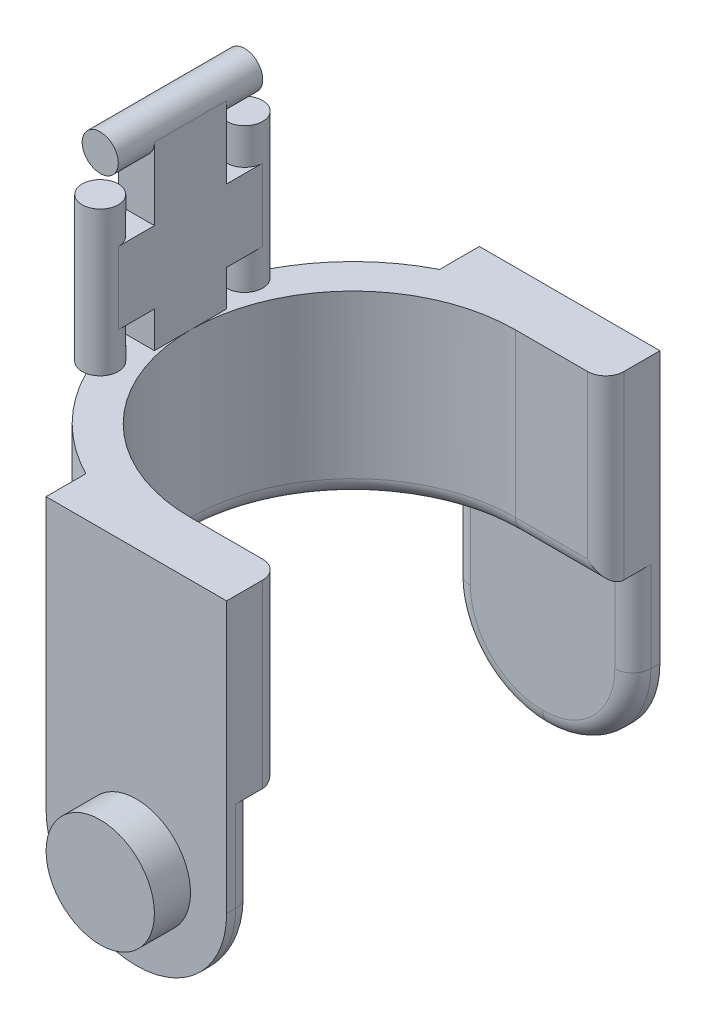
from build123d import *

# Parameters (mm, degrees)
BOSS_EXTRUDE1_DEPTH      = 50
SKETCH2_W                = 50
SKETCH2_H                = 15
BOSS_EXTRUDE2_DEPTH      = 50
SKETCH3_W                = 50
SKETCH3_H                = 7.5
BOSS_EXTRUDE3_DEPTH      = 50
SKETCH4_R                = 15
BOSS_EXTRUDE4_DEPTH      = 10
FILLET1_R                = 25
FILLET1_OF_MIRROR1_R     = 25
FILLET2_R                = 5
SKETCH5_W                = 10
SKETCH5_H                = 10
BOSS_EXTRUDE5_DEPTH      = 40
SKETCH6_W                = 10
SKETCH6_H                = 20
BOSS_EXTRUDE6_DEPTH      = 10
BOSS_EXTRUDE7_START      = -30
SKETCH7_R                = 5
BOSS_EXTRUDE7_DEPTH      = 40
SKETCH8_W                = 10
SKETCH8_H                = 20
BOSS_EXTRUDE8_DEPTH      = 10
BOSS_EXTRUDE9_DEPTH      = 20
BOSS_EXTRUDE9_DEPTH_BACK = 20
SKETCH9_R                = 5


with BuildPart() as part:
    # Sketch1 → Boss-Extrude1 (new body)
    with BuildSketch(Plane(origin=(0, 0, 0), x_dir=(1, 0, 0), z_dir=(0, 1, 0))):
        with BuildLine():
            Line((0, 55), (0, 45))
            ThreePointArc((0, 45), (-45, 0), (0, -45))
            Line((0, -45), (0, -55))
            ThreePointArc((0, -55), (-55, 0), (0, 55))
        make_face()
    extrude(amount=BOSS_EXTRUDE1_DEPTH)

    # Sketch2 → Boss-Extrude2 (add)
    with BuildSketch(Plane(origin=(0, 0, 0), x_dir=(1, 0, 0), z_dir=(0, 1, 0))):
        with Locations((0, -52.5)):
            Rectangle(SKETCH2_W, SKETCH2_H)
    boss_extrude2 = extrude(amount=BOSS_EXTRUDE2_DEPTH)

    # Sketch3 → Boss-Extrude3 (add)
    with BuildSketch(Plane.XZ):
        with Locations((0, 56.25)):
            Rectangle(SKETCH3_W, SKETCH3_H)
    boss_extrude3 = extrude(amount=BOSS_EXTRUDE3_DEPTH)

    # Sketch4 → Boss-Extrude4 (add)
    with BuildSketch(Plane.XY.offset(60)):
        with Locations(Location((0, -25, 0), (0, 0, 180))):
            Circle(SKETCH4_R)
    boss_extrude4 = extrude(amount=BOSS_EXTRUDE4_DEPTH)

    # Fillet1
    fillet1_edges = [part.edges().sort_by_distance(p)[0] for p in [
        (-25, -50, 56.25),
        (25, -50, 56.25),
    ]]
    fillet(fillet1_edges, radius=FILLET1_R - 0.0001)  # a hair under: the kernel refuses the full size

    # Mirror1: Boss-Extrude2, Boss-Extrude3, Boss-Extrude4 across plane
    add(boss_extrude2.mirror(Plane.XY))
    add(boss_extrude3.mirror(Plane.XY))
    add(boss_extrude4.mirror(Plane.XY))

    # Fillet1 of Mirror1
    fillet1_of_mirror1_edges = [part.edges().sort_by_distance(p)[0] for p in [
        (-25, -50, -56.25),
        (25, -50, -56.25),
    ]]
    fillet(fillet1_of_mirror1_edges, radius=FILLET1_OF_MIRROR1_R - 0.0001)  # a hair under: the kernel refuses the full size

    # Fillet2
    fillet2_edges = [part.edges().sort_by_distance(p)[0] for p in [
        (-25, -12.50005, -52.5),
        (-17.677698819, -42.677698819, -52.5),
        (17.677698819, -42.677698819, -52.5),
        (-25, -12.50005, 52.5),
        (-17.677698819, -42.677698819, 52.5),
        (17.677698819, -42.677698819, 52.5),
        (12.5, 0, 45),
        (12.5, 0, -45),
        (-55, 0, 0),
        (25, -12.50005, -52.5),
        (25, -12.50005, 52.5),
        (-45, 0, 0),
        (25, 25, 45),
        (25, 25, -45),
    ]]
    fillet(fillet2_edges, radius=FILLET2_R - 0.0001)  # a hair under: the kernel refuses the full size

    # Sketch5 → Boss-Extrude5 (add)
    with BuildSketch(Plane(origin=(0, 50, 0), x_dir=(1, 0, 0), z_dir=(0, 1, 0))):
        with Locations((-50, -5)):
            Rectangle(SKETCH5_W, SKETCH5_H)
    boss_extrude5 = extrude(amount=BOSS_EXTRUDE5_DEPTH)

    # Sketch6 → Boss-Extrude6 (add)
    with BuildSketch(Plane.XY.offset(10)):
        with Locations((-50, 70)):
            Rectangle(SKETCH6_W, SKETCH6_H)
    boss_extrude6 = extrude(amount=BOSS_EXTRUDE6_DEPTH)

    # Sketch7 → Boss-Extrude7 (add)
    with BuildSketch(Plane(origin=(0, 80, 0), x_dir=(1, 0, 0), z_dir=(0, 1, 0)).offset(BOSS_EXTRUDE7_START)):
        with Locations(Location((-50, -20, 0), (0, 0, 270))):
            Circle(SKETCH7_R)
    boss_extrude7 = extrude(amount=BOSS_EXTRUDE7_DEPTH)

    # Mirror2: Boss-Extrude5, Boss-Extrude6, Boss-Extrude7 across plane
    add(boss_extrude5.mirror(Plane(origin=(-45, 90, 0), x_dir=(1, 0, 0), z_dir=(0, 0, 1))))
    add(boss_extrude6.mirror(Plane(origin=(-45, 90, 0), x_dir=(1, 0, 0), z_dir=(0, 0, 1))))
    add(boss_extrude7.mirror(Plane(origin=(-45, 90, 0), x_dir=(1, 0, 0), z_dir=(0, 0, 1))))

    # Sketch8 → Boss-Extrude8 (add)
    with BuildSketch(Plane(origin=(0, 90, 0), x_dir=(1, 0, 0), z_dir=(0, 1, 0))):
        with Locations((-50, 0)):
            Rectangle(SKETCH8_W, SKETCH8_H)
    extrude(amount=BOSS_EXTRUDE8_DEPTH)

    # Sketch9 → Boss-Extrude9 (add, two sides: drawn at the far end of the back side and taken through both)
    with BuildSketch(Plane.XY.offset(-BOSS_EXTRUDE9_DEPTH_BACK)):
        with Locations((-50, 100)):
            Circle(SKETCH9_R)
    extrude(amount=BOSS_EXTRUDE9_DEPTH + BOSS_EXTRUDE9_DEPTH_BACK)


solid = part.part
